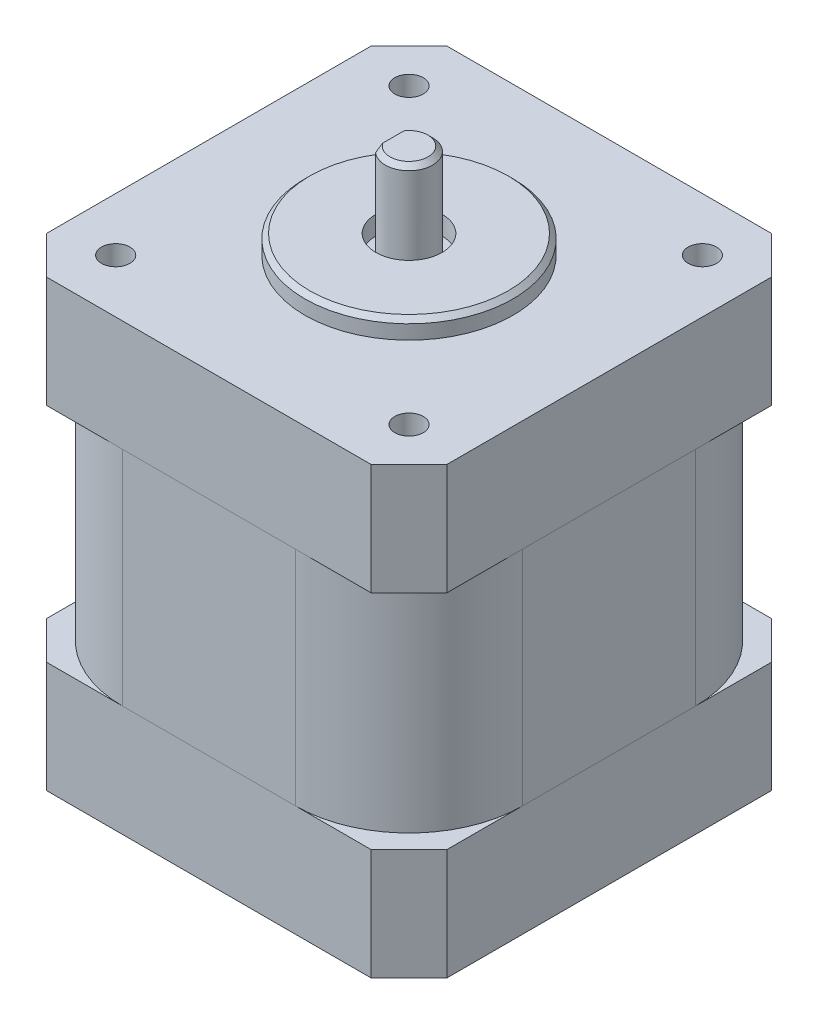
from build123d import *
from build123d.topology import SkipClean

# Parameters (mm, degrees)
SKETCH1_W               = 42.3
SKETCH1_H               = 42.3
BOSS_EXTRUDE1_DEPTH     = 11.75
SKETCH2_W               = 42.3
SKETCH2_H               = 42.3
BOSS_EXTRUDE2_DEPTH     = 23.5
FILLET2_R               = 12
SKETCH4_W               = 42.3
SKETCH4_H               = 42.3
BOSS_EXTRUDE3_DEPTH     = 11.75
SKETCH6_W               = 42.3
SKETCH6_H               = 42.3
BOSS_EXTRUDE4_DEPTH     = 11.75
CHAMFER3_SIZE           = 4
CHAMFER4_SIZE           = 4
SKETCH7_R               = 11
BOSS_EXTRUDE5_DEPTH     = 2
SKETCH8_R               = 2.5
BOSS_EXTRUDE6_DEPTH     = 10
CHAMFER5_SIZE           = 0.5
CHAMFER9_SIZE           = 0.5
SKETCH15_W              = 1.000182245
SKETCH15_H              = 2.5
SKETCH18_R              = 1.5
CUT_EXTRUDE4_DEPTH      = 10
CUT_EXTRUDE5_DEPTH      = 65.37115037
CUT_EXTRUDE5_DEPTH_BACK = 65.37115037
CHAMFER11_SIZE          = 1


with BuildPart() as part:
    # Sketch1 → Boss-Extrude1 (new body)
    with BuildSketch(Plane(origin=(0, 0, 0), x_dir=(1, 0, 0), z_dir=(0, 1, 0))):
        Rectangle(SKETCH1_W, SKETCH1_H)
    extrude(amount=BOSS_EXTRUDE1_DEPTH)

    # Sketch4 → Boss-Extrude3 (add)
    with BuildSketch(Plane(origin=(0, 0, 0), x_dir=(1, 0, 0), z_dir=(0, 1, 0))):
        Rectangle(SKETCH4_W, SKETCH4_H)
    extrude(amount=BOSS_EXTRUDE3_DEPTH)

    # Chamfer3
    chamfer3_edges = [part.edges().sort_by_distance(p)[0] for p in [
        (21.15, 5.875, -21.15),
        (21.15, 5.875, 21.15),
        (-21.15, 5.875, 21.15),
        (-21.15, 5.875, -21.15),
    ]]
    chamfer(chamfer3_edges, length=CHAMFER3_SIZE)


with BuildPart() as body_2:
    # Sketch2 → Boss-Extrude2 (new body)
    with BuildSketch(Plane(origin=(0, 11.75, 0), x_dir=(1, 0, 0), z_dir=(0, 1, 0))):
        Rectangle(SKETCH2_W, SKETCH2_H)
    extrude(amount=BOSS_EXTRUDE2_DEPTH)

    # Fillet2
    fillet2_edges = [body_2.edges().sort_by_distance(p)[0] for p in [
        (21.15, 23.5, -21.15),
        (21.15, 23.5, 21.15),
        (-21.15, 23.5, 21.15),
        (-21.15, 23.5, -21.15),
    ]]
    fillet(fillet2_edges, radius=FILLET2_R)


with BuildPart() as body_3:
    # Sketch6 → Boss-Extrude4 (new body)
    with BuildSketch(Plane(origin=(0, 35.25, 0), x_dir=(1, 0, 0), z_dir=(0, 1, 0))):
        Rectangle(SKETCH6_W, SKETCH6_H)
    extrude(amount=BOSS_EXTRUDE4_DEPTH)

    # Chamfer4
    chamfer4_edges = [body_3.edges().sort_by_distance(p)[0] for p in [
        (21.15, 41.125, -21.15),
        (21.15, 41.125, 21.15),
        (-21.15, 41.125, 21.15),
        (-21.15, 41.125, -21.15),
    ]]
    chamfer(chamfer4_edges, length=CHAMFER4_SIZE)

    # Sketch7 → Boss-Extrude5 (add)
    with BuildSketch(Plane(origin=(0, 47, 0), x_dir=(1, 0, 0), z_dir=(0, 1, 0))):
        with Locations(Location((0, 0, 0), (0, 0, 270))):
            Circle(SKETCH7_R)
    extrude(amount=BOSS_EXTRUDE5_DEPTH)

    # Sketch8 → Boss-Extrude6 (add)
    with BuildSketch(Plane(origin=(0, 47, 0), x_dir=(1, 0, 0), z_dir=(0, 1, 0))):
        with Locations(Location((0, 0, 0), (0, 0, 270))):
            Circle(SKETCH8_R)
    extrude(amount=BOSS_EXTRUDE6_DEPTH)

    # Chamfer5
    chamfer5_edges = [body_3.edges().sort_by_distance(p)[0] for p in [
        (0, 57, -2.5),
    ]]
    chamfer(chamfer5_edges, length=CHAMFER5_SIZE)

    # Chamfer9
    chamfer9_edges = [body_3.edges().sort_by_distance(p)[0] for p in [
        (0, 49, -11),
    ]]
    chamfer(chamfer9_edges, length=CHAMFER9_SIZE)

    # Sketch15 → Cut-Revolve1 (revolve, cut)
    with SkipClean():  # the faces are left unmerged after this step: merging them gives an invalid solid
        with BuildSketch(Plane.XY, mode=Mode.PRIVATE) as cut_revolve1_sk:
            with Locations((3.000091123, 48.25)):
                Rectangle(SKETCH15_W, SKETCH15_H)
        revolve(cut_revolve1_sk.sketch.rotate(Axis((0, 0, 0), (0, 1, 0)), 90), axis=Axis((0, 0, 0), (0, 1, 0)), mode=Mode.SUBTRACT)

    # Sketch18 → Cut-Extrude4 (cut)
    with SkipClean():  # the faces are left unmerged after this step: merging them gives an invalid solid
        with BuildSketch(Plane(origin=(0, 47, 0), x_dir=(1, 0, 0), z_dir=(0, 1, 0))):
            with Locations(Location((15.5, 15.503856364, 0), (0, 0, 270))):
                Circle(SKETCH18_R)
            with Locations(Location((15.5, -15.496143636, 0), (0, 0, 270))):
                Circle(SKETCH18_R)
            with Locations(Location((-15.5, -15.496143636, 0), (0, 0, 270))):
                Circle(SKETCH18_R)
            with Locations(Location((-15.5, 15.503856364, 0), (0, 0, 270))):
                Circle(SKETCH18_R)
        extrude(amount=-CUT_EXTRUDE4_DEPTH, mode=Mode.SUBTRACT)

    # Sketch19 → Cut-Extrude5 (cut, two sides: drawn at the far end of the back side and taken through both)
    with BuildSketch(Plane.XY.offset(-CUT_EXTRUDE5_DEPTH_BACK)):
        Polygon((-2.5, 56.5), (-2.5, 49), (-1.65, 49), (-1.65, 57), (-2, 57), align=None)
    extrude(amount=CUT_EXTRUDE5_DEPTH + CUT_EXTRUDE5_DEPTH_BACK, mode=Mode.SUBTRACT)

    # Chamfer11
    # the kernel refuses this chamfer: 1 mm, written as the material it adds along each edge
    with BuildSketch(Plane(origin=(-1.65, 49, -4.449846985), x_dir=(0.0274958766105862, 0.9996219169112968, 0), z_dir=(0, 0, 1))) as chamfer11_piece_1_section:
        Polygon((CHAMFER11_SIZE * 0.999621916911, CHAMFER11_SIZE * 0.0274958766106), (-CHAMFER11_SIZE * 0.0274958766106, CHAMFER11_SIZE * 0.999621916911), (0, 0), align=None)
    chamfer11_piece_1 = extrude(amount=8.89969397, mode=Mode.PRIVATE)
    chamfer11_piece_1 = chamfer11_piece_1 & Plane(origin=(0, 49.369319322, 0), x_dir=(0, 0, -1), z_dir=(0, 1, 0)) * Cylinder(2.5, 22, mode=Mode.PRIVATE)
    add(chamfer11_piece_1)


solid = Compound([part.part, body_2.part, body_3.part])
